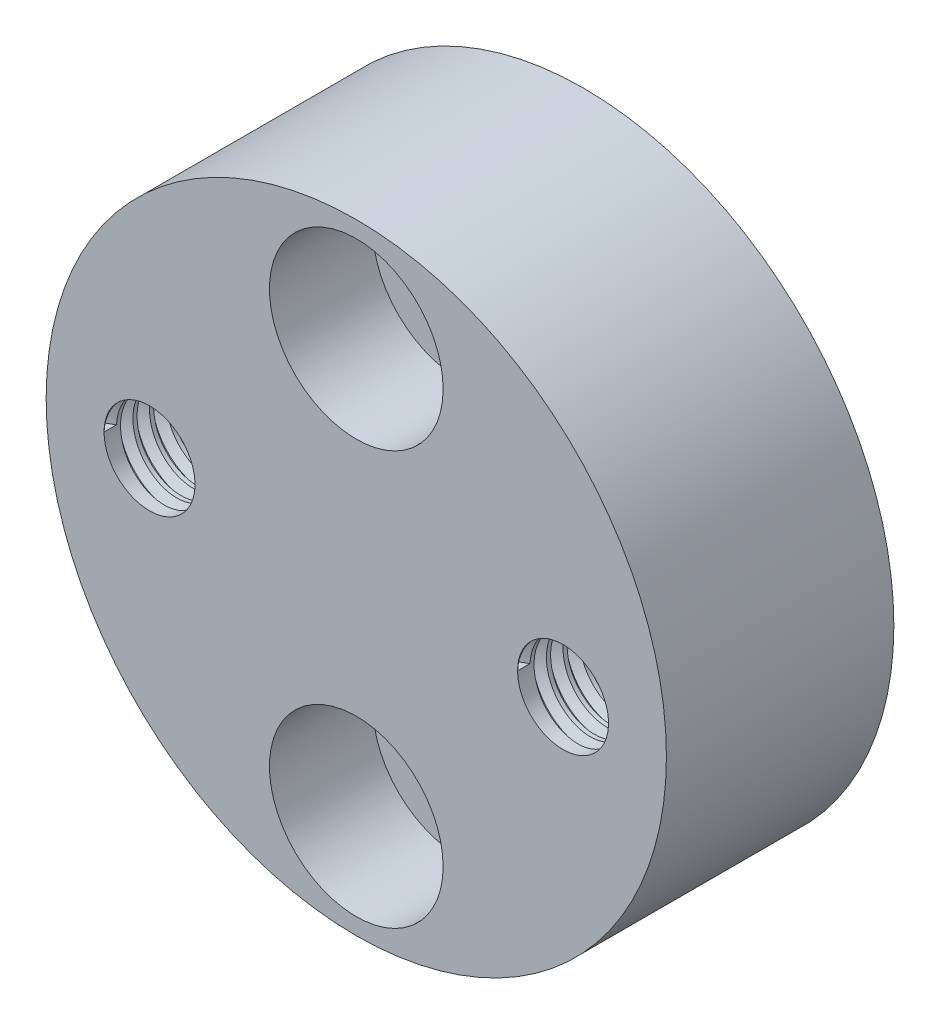
from build123d import *

# Parameters (mm, degrees)
SKIZZE1_R                       = 15
AUFSATZ_LINEAR_AUSTRAGEN1_DEPTH = 11
SKIZZE2_R                       = 2.5
SKIZZE2_R_2                     = 2.2
SCHNITT_LINEAR_AUSTRAGEN1_DEPTH = 33
SKIZZE3_R                       = 4.2
SCHNITT_LINEAR_AUSTRAGEN2_DEPTH = 5
GEWINDE1_PITCH                  = 0.8
GEWINDE2_PITCH                  = 0.8


with BuildPart() as part:
    # Skizze1 → Aufsatz-Linear austragen1 (new body)
    with BuildSketch(Plane.XY):
        Circle(SKIZZE1_R)
    extrude(amount=AUFSATZ_LINEAR_AUSTRAGEN1_DEPTH)

    # Skizze2 → Schnitt-Linear austragen1 (cut)
    with BuildSketch(Plane.XY.offset(11)):
        with Locations((0, 10)):
            Circle(SKIZZE2_R)
        with Locations((10, 0)):
            Circle(SKIZZE2_R_2)
        with Locations((0, -10)):
            Circle(SKIZZE2_R)
        with Locations((-10, 0)):
            Circle(SKIZZE2_R_2)
    extrude(amount=-SCHNITT_LINEAR_AUSTRAGEN1_DEPTH, mode=Mode.SUBTRACT)

    # Skizze3 → Schnitt-Linear austragen2 (cut)
    with BuildSketch(Plane.XY.offset(11)):
        with Locations((0, 10)):
            Circle(SKIZZE3_R)
        with Locations((0, -10)):
            Circle(SKIZZE3_R)
    extrude(amount=-SCHNITT_LINEAR_AUSTRAGEN2_DEPTH, mode=Mode.SUBTRACT)

    # Gewinde1: arcs per turn and ends read off the stored shape
    # Gewinde1: the profile of Gewindeprofil1 profile screwed along a right-hand helix through 25 turns, 8 arcs to a turn; built about Z, then put on its axis
    gewinde1_z = Axis((0, 0, 0), (0, 0, 1))
    gewinde1_corners = [(2.1997, 0, -0.000173205), (2.6330127, 0, 0.249999999), (2.6330127, 0, 0.349999999), (2.1997, 0, 0.600173203)]
    with BuildLine(mode=Mode.PRIVATE) as gewinde1_profile:
        Line(gewinde1_corners[0], gewinde1_corners[1])
        Line(gewinde1_corners[1], gewinde1_corners[2])
        Line(gewinde1_corners[2], gewinde1_corners[3])
        Line(gewinde1_corners[3], gewinde1_corners[0])
    gewinde1_cap = Face(gewinde1_profile.wire())
    gewinde1_turn_angles = [0, 22.5, 45, 67.5, 90, 112.5, 135, 157.5, 180, 202.5, 225, 247.5, 270, 292.5, 315, 337.5, 360]
    gewinde1_turn_weights = [1, 0.9238795325112867, 1, 0.9238795325112867, 1, 0.9238795325112867, 1, 0.9238795325112867, 1, 0.9238795325112867, 1, 0.9238795325112867, 1, 0.9238795325112867, 1, 0.9238795325112867, 1]
    gewinde1_turn_rails = [Edge.make_bspline([Vector(p[0], p[1], 0).rotate(gewinde1_z, gewinde1_turn_angles[k]) / gewinde1_turn_weights[k] + Vector(0, 0, p[2] + GEWINDE1_PITCH * gewinde1_turn_angles[k] / 360) for k in range(17)], [0, 0, 0, 1, 1, 2, 2, 3, 3, 4, 4, 5, 5, 6, 6, 7, 7, 8, 8, 8], 2, gewinde1_turn_weights) for p in gewinde1_corners]
    gewinde1_turn_sides = [Face.make_surface_from_curves(gewinde1_turn_rails[p[0]], gewinde1_turn_rails[p[1]]) for p in [(0, 1), (1, 2), (2, 3), (3, 0)]]
    gewinde1 = Plane(origin=(-10, 0, 11), x_dir=(-1, 0, 0), z_dir=(0, 0, -1)) * Solid(Shell([*[p.moved(Location((0, 0, GEWINDE1_PITCH * i))) for i in range(25) for p in gewinde1_turn_sides], gewinde1_cap, gewinde1_cap.rotate(gewinde1_z, 9000).moved(Location((0, 0, GEWINDE1_PITCH * 9000 / 360)))]))
    add(gewinde1, mode=Mode.SUBTRACT)

    # Gewinde2: arcs per turn and ends read off the stored shape
    # Gewinde2: the profile of Gewindeprofil2 profile screwed along a right-hand helix through 25 turns, 8 arcs to a turn; built about Z, then put on its axis
    gewinde2_z = Axis((0, 0, 0), (0, 0, 1))
    gewinde2_corners = [(2.1997, 0, -0.000173205), (2.6330127, 0, 0.249999999), (2.6330127, 0, 0.349999999), (2.1997, 0, 0.600173203)]
    with BuildLine(mode=Mode.PRIVATE) as gewinde2_profile:
        Line(gewinde2_corners[0], gewinde2_corners[1])
        Line(gewinde2_corners[1], gewinde2_corners[2])
        Line(gewinde2_corners[2], gewinde2_corners[3])
        Line(gewinde2_corners[3], gewinde2_corners[0])
    gewinde2_cap = Face(gewinde2_profile.wire())
    gewinde2_turn_angles = [0, 22.5, 45, 67.5, 90, 112.5, 135, 157.5, 180, 202.5, 225, 247.5, 270, 292.5, 315, 337.5, 360]
    gewinde2_turn_weights = [1, 0.9238795325112867, 1, 0.9238795325112867, 1, 0.9238795325112867, 1, 0.9238795325112867, 1, 0.9238795325112867, 1, 0.9238795325112867, 1, 0.9238795325112867, 1, 0.9238795325112867, 1]
    gewinde2_turn_rails = [Edge.make_bspline([Vector(p[0], p[1], 0).rotate(gewinde2_z, gewinde2_turn_angles[k]) / gewinde2_turn_weights[k] + Vector(0, 0, p[2] + GEWINDE2_PITCH * gewinde2_turn_angles[k] / 360) for k in range(17)], [0, 0, 0, 1, 1, 2, 2, 3, 3, 4, 4, 5, 5, 6, 6, 7, 7, 8, 8, 8], 2, gewinde2_turn_weights) for p in gewinde2_corners]
    gewinde2_turn_sides = [Face.make_surface_from_curves(gewinde2_turn_rails[p[0]], gewinde2_turn_rails[p[1]]) for p in [(0, 1), (1, 2), (2, 3), (3, 0)]]
    gewinde2 = Plane(origin=(10, 0, 11), x_dir=(-1, 0, 0), z_dir=(0, 0, -1)) * Solid(Shell([*[p.moved(Location((0, 0, GEWINDE2_PITCH * i))) for i in range(25) for p in gewinde2_turn_sides], gewinde2_cap, gewinde2_cap.rotate(gewinde2_z, 9000).moved(Location((0, 0, GEWINDE2_PITCH * 9000 / 360)))]))
    add(gewinde2, mode=Mode.SUBTRACT)


solid = part.part
